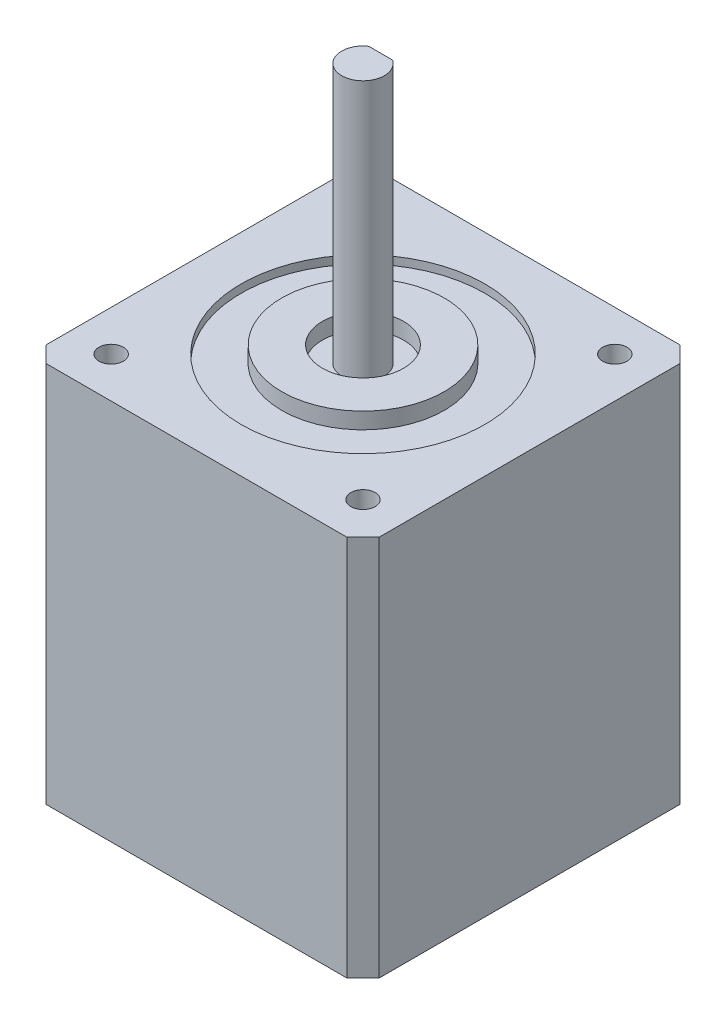
from build123d import *

# Parameters (mm, degrees)
BOSS_EXTRUDE1_DEPTH          = 47
SKETCH2_R                    = 15
CUT_EXTRUDE1_DEPTH           = 1
SKETCH3_R                    = 10
SKETCH3_R_2                  = 5
BOSS_EXTRUDE2_DEPTH          = 2
BOSS_EXTRUDE3_DEPTH          = 32
F_3_0_3_DIAMETER_HOLE1_D     = 3
F_3_0_3_DIAMETER_HOLE1_DEPTH = 5
F_3_0_3_DIAMETER_HOLE1_TIP   = 0.901290929


with BuildPart() as part:
    # Sketch1 → Boss-Extrude1 (new body)
    with BuildSketch(Plane(origin=(0, 0, 0), x_dir=(1, 0, 0), z_dir=(0, 1, 0))):
        Polygon((-20.5, 18.5), (-18.5, 20.5), (18.5, 20.5), (20.5, 18.5), (20.5, -18.5), (18.5, -20.5), (-18.5, -20.5), (-20.5, -18.5), align=None)
    extrude(amount=BOSS_EXTRUDE1_DEPTH)

    # Sketch2 → Cut-Extrude1 (cut)
    with BuildSketch(Plane(origin=(0, 47, 0), x_dir=(-1, 0, 0), z_dir=(0, 1, 0))):
        Circle(SKETCH2_R)
    extrude(amount=-CUT_EXTRUDE1_DEPTH, mode=Mode.SUBTRACT)

    # Sketch3 → Boss-Extrude2 (add)
    with BuildSketch(Plane(origin=(0, 46, 0), x_dir=(1, 0, 0), z_dir=(0, 1, 0))):
        Circle(SKETCH3_R)
        Circle(SKETCH3_R_2, mode=Mode.SUBTRACT)
    extrude(amount=BOSS_EXTRUDE2_DEPTH)

    # Sketch4 → Boss-Extrude3 (add)
    with BuildSketch(Plane(origin=(0, 46, 0), x_dir=(1, 0, 0), z_dir=(0, 1, 0))):
        with BuildLine():
            Line((-1.470984161, 2.175359116), (1.470984161, 2.175359116))
            ThreePointArc((1.470984161, 2.175359116), (0, -2.626020123), (-1.470984161, 2.175359116))
        make_face()
    extrude(amount=BOSS_EXTRUDE3_DEPTH)

    # Ø3.0 (3) Diameter Hole1
    with Locations(Plane(origin=(0, 47, 0), x_dir=(-1, 0, 0), z_dir=(0, 1, 0))):
        with Locations((-15.5, -15.5), (15.5, -15.5), (15.5, 15.5), (-15.5, 15.5)):
            Hole(F_3_0_3_DIAMETER_HOLE1_D / 2, depth=F_3_0_3_DIAMETER_HOLE1_DEPTH)
            with Locations((0, 0, -(F_3_0_3_DIAMETER_HOLE1_DEPTH + F_3_0_3_DIAMETER_HOLE1_TIP / 2))):  # 118° drill point
                Cone(0, F_3_0_3_DIAMETER_HOLE1_D / 2, F_3_0_3_DIAMETER_HOLE1_TIP, mode=Mode.SUBTRACT)


solid = part.part
